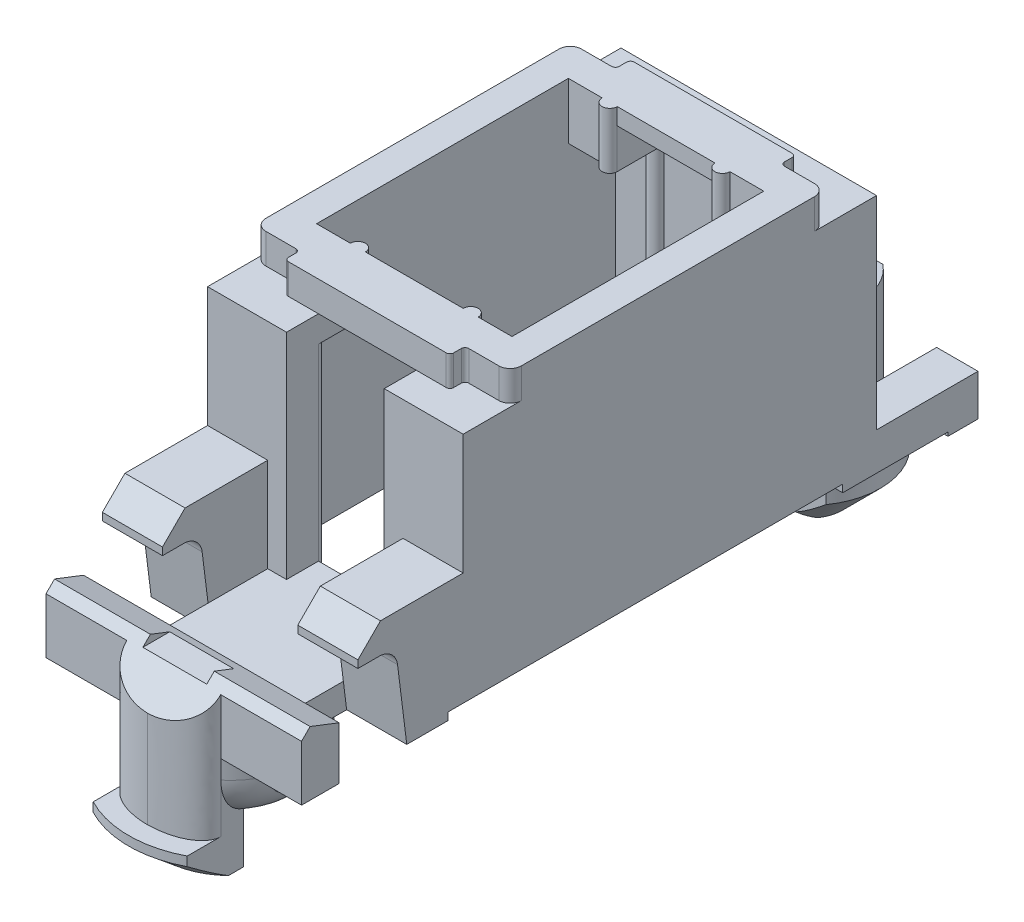
from build123d import *

# Parameters (mm, degrees)
BOSS_EXTRUDE1_DEPTH     = 3.4
CUT_EXTRUDE1_DEPTH      = 12.56460116
CUT_EXTRUDE1_DEPTH_BACK = 12.56460116
SKETCH3_W               = 3.6
SKETCH3_H               = 5.6
SKETCH3_W_2             = 4.6
SKETCH3_H_2             = 5.4
SKETCH4_W               = 2.6
SKETCH4_H               = 12.8
CUT_EXTRUDE3_DEPTH      = 2.8
SKETCH5_OUTSIDE_W       = 12.656
SKETCH5_OUTSIDE_H       = 22.356
CUT_EXTRUDE4_DEPTH      = 0.8
CUT_EXTRUDE5_DEPTH      = 5.5
CUT_EXTRUDE6_DEPTH      = 1.3
CUT_EXTRUDE6_DEPTH_BACK = 1.3
BOSS_EXTRUDE2_REACH     = 12.47
CUT_EXTRUDE7_DEPTH      = 13.241323458
CUT_EXTRUDE7_DEPTH_BACK = 13.241323458
SKETCH11_W              = 6.8
SKETCH11_H              = 4.491916375
CUT_EXTRUDE8_START      = -2.200001
SKETCH12_W              = 1.498956088
SKETCH12_H              = 8.6
CUT_EXTRUDE8_DEPTH      = 2.200002
BOSS_EXTRUDE3_DEPTH     = 0.5
SKETCH14_W              = 4.6
SKETCH14_H              = 0.5
CUT_EXTRUDE9_DEPTH      = 1.4
BOSS_EXTRUDE4_START     = -0.866025
BOSS_EXTRUDE4_DEPTH     = 1.73205
SKETCH16_W              = 0.732050808
SKETCH16_H              = 2.4
CUT_EXTRUDE10_DEPTH     = 4.2
FILLET1_R               = 0.5
FILLET2_R               = 0.2
SKETCH17_R              = 1.95
SKETCH17_R_2            = 0.85
BOSS_EXTRUDE6_DEPTH     = 1.5
FILLET3_SIZE            = 1
FILLET3_SIZE_2          = 0.6
CUT_EXTRUDE11_DEPTH     = 1.5
CUT_EXTRUDE13_START     = -6.4
CUT_EXTRUDE13_OUTLINE_R = 0.799999943
CUT_EXTRUDE13_DEPTH     = 3.5
BOSS_EXTRUDE8_DEPTH     = 3.4
BOSS_EXTRUDE9_REACH     = 15.222
FILLET5_START           = -5.4
FILLET5_DEPTH           = 3.5
SKETCH23_W              = 1.7
SKETCH23_H              = 0.4
CUT_EXTRUDE14_DEPTH     = 14.221573389


with BuildPart() as part:
    # Sketch2 → Boss-Extrude1 (new, symmetric)
    with BuildSketch(Plane(origin=(0, 0, 0), x_dir=(0, 0, -1), z_dir=(1, 0, 0))):
        with BuildLine():
            Line((-5.5, 3.6), (5.5, 3.6))
            Line((5.5, 3.6), (5.5, -2.599948203))
            Line((5.5, -2.599948203), (8.2, -2.599948203))
            Line((8.2, -2.599948203), (8.2, -3.7))
            Line((8.2, -3.7), (7.4, -3.7))
            Line((7.4, -3.7), (7.4, -3.6))
            Line((7.4, -3.6), (4.6, -3.6))
            Line((4.6, -3.6), (4.6, -3.4))
            Line((4.6, -3.4), (-5.9, -3.4))
            Line((-5.9, -3.4), (-5.9, -3.6))
            Line((-5.9, -3.6), (-7, -3.6))
            Line((-7, -3.6), (-7.245252171, -1.637982633))
            ThreePointArc((-7.245252171, -1.637982633), (-7.410489828, -1.325160912), (-7.741391109, -1.2))
            Line((-7.741391109, -1.2), (-8.3, -1.2))
            Line((-8.3, -1.2), (-8.3, -1))
            Line((-8.3, -1), (-7.7, -0.4))
            Line((-7.7, -0.4), (-5.5, -0.4))
            Line((-5.5, -0.4), (-5.5, 3.6))
        make_face()
    extrude(amount=BOSS_EXTRUDE1_DEPTH, both=True)

    # Sketch3 → Cut-Extrude1 (cut, two sides: drawn at the far end of the back side and taken through both)
    with BuildSketch(Plane(origin=(0, 3.6, 0), x_dir=(1, 0, 0), z_dir=(0, 1, 0)).offset(-CUT_EXTRUDE1_DEPTH_BACK)):
        with BuildLine():
            Line((-2.6, 3.3), (-1.7, 3.3))
            ThreePointArc((-1.7, 3.3), (-1.5, 3.1), (-1.3, 3.3))
            Line((-1.3, 3.3), (1.3, 3.3))
            ThreePointArc((1.3, 3.3), (1.5, 3.1), (1.7, 3.3))
            Line((1.7, 3.3), (2.6, 3.3))
            Line((2.6, 3.3), (2.6, -3.4))
            Line((2.6, -3.4), (1.7, -3.4))
            ThreePointArc((1.7, -3.4), (1.5, -3.2), (1.3, -3.4))
            Line((1.3, -3.4), (-1.3, -3.4))
            ThreePointArc((-1.3, -3.4), (-1.5, -3.2), (-1.7, -3.4))
            Line((-1.7, -3.4), (-2.6, -3.4))
            Line((-2.6, -3.4), (-2.6, 3.3))
        make_face()
        with Locations((0, -8.3)):
            Rectangle(SKETCH3_W, SKETCH3_H)
        with Locations((0, 8.2)):
            Rectangle(SKETCH3_W_2, SKETCH3_H_2)
    extrude(amount=CUT_EXTRUDE1_DEPTH + CUT_EXTRUDE1_DEPTH_BACK, mode=Mode.SUBTRACT)

    # Sketch4 → Cut-Extrude3 (cut)
    with BuildSketch(Plane.XY.offset(5.5)):
        with Locations((0, -3.6)):
            Rectangle(SKETCH4_W, SKETCH4_H)
    extrude(amount=-CUT_EXTRUDE3_DEPTH, mode=Mode.SUBTRACT)

    # Sketch5 outside → Cut-Extrude4 (cut)
    with BuildSketch(Plane(origin=(0, 3.6, 0), x_dir=(1, 0, 0), z_dir=(0, 1, 0))):
        with Locations((0, -0.05)):
            Rectangle(SKETCH5_OUTSIDE_W, SKETCH5_OUTSIDE_H)
        with BuildLine():
            Line((-2.1, -4.65), (2.1, -4.65))
            ThreePointArc((2.1, -4.65), (2.170710678, -4.620710678), (2.2, -4.55))
            Line((2.2, -4.55), (2.2, -4.35))
            ThreePointArc((2.2, -4.35), (2.229289322, -4.279289322), (2.3, -4.25))
            Line((2.3, -4.25), (3.1, -4.25))
            ThreePointArc((3.1, -4.25), (3.312132034, -4.162132034), (3.4, -3.95))
            Line((3.4, -3.95), (3.4, 3.85))
            ThreePointArc((3.4, 3.85), (3.312132034, 4.062132034), (3.1, 4.15))
            Line((3.1, 4.15), (2.3, 4.15))
            ThreePointArc((2.3, 4.15), (2.229289322, 4.179289322), (2.2, 4.25))
            Line((2.2, 4.25), (2.2, 4.45))
            ThreePointArc((2.2, 4.45), (2.170710678, 4.520710678), (2.1, 4.55))
            Line((2.1, 4.55), (-2.1, 4.55))
            ThreePointArc((-2.1, 4.55), (-2.170710678, 4.520710678), (-2.2, 4.45))
            Line((-2.2, 4.45), (-2.2, 4.25))
            ThreePointArc((-2.2, 4.25), (-2.229289322, 4.179289322), (-2.3, 4.15))
            Line((-2.3, 4.15), (-3.1, 4.15))
            ThreePointArc((-3.1, 4.15), (-3.312132034, 4.062132034), (-3.4, 3.85))
            Line((-3.4, 3.85), (-3.4, -3.95))
            ThreePointArc((-3.4, -3.95), (-3.312132034, -4.162132034), (-3.1, -4.25))
            Line((-3.1, -4.25), (-2.3, -4.25))
            ThreePointArc((-2.3, -4.25), (-2.229289322, -4.279289322), (-2.2, -4.35))
            Line((-2.2, -4.35), (-2.2, -4.55))
            ThreePointArc((-2.2, -4.55), (-2.170710678, -4.620710678), (-2.1, -4.65))
        make_face(mode=Mode.SUBTRACT)
    extrude(amount=-CUT_EXTRUDE4_DEPTH, mode=Mode.SUBTRACT)

    # Sketch6 → Cut-Extrude5 (cut)
    with BuildSketch(Plane.XZ.offset(3.4)):
        with BuildLine():
            Line((-2.6, 4.65), (-1.7, 4.65))
            ThreePointArc((-1.7, 4.65), (-1.5, 4.45), (-1.3, 4.65))
            Line((-1.3, 4.65), (1.3, 4.65))
            ThreePointArc((1.3, 4.65), (1.5, 4.45), (1.7, 4.65))
            Line((1.7, 4.65), (2.6, 4.65))
            Line((2.6, 4.65), (2.6, -2.52625277))
            Line((2.6, -2.52625277), (1.3, -2.52625277))
            Line((1.3, -2.52625277), (1.3, -4.55))
            Line((1.3, -4.55), (-1.3, -4.55))
            ThreePointArc((-1.3, -4.55), (-1.5, -4.35), (-1.7, -4.55))
            Line((-1.7, -4.55), (-2.6, -4.55))
            Line((-2.6, -4.55), (-2.6, 4.65))
        make_face()
    extrude(amount=-CUT_EXTRUDE5_DEPTH, mode=Mode.SUBTRACT)

    # Sketch7 → Cut-Extrude6 (cut, two sides: drawn at the far end of the back side and taken through both)
    with BuildSketch(Plane(origin=(0, 0, 0), x_dir=(0, 0, -1), z_dir=(1, 0, 0)).offset(-CUT_EXTRUDE6_DEPTH_BACK)):
        with BuildLine():
            Line((4.55, 1.317385314), (4.55, 2.634395244))
            ThreePointArc((4.55, 2.634395244), (4.462132034, 2.846527278), (4.25, 2.934395244))
            Line((4.25, 2.934395244), (3.569822156, 2.934395244))
            Line((3.569822156, 2.934395244), (3.569822156, 3.155123578))
            Line((3.569822156, 3.155123578), (3.3, 3.155123578))
            Line((3.3, 3.155123578), (3.3, 1.317385314))
            Line((3.3, 1.317385314), (4.55, 1.317385314))
        make_face()
    extrude(amount=CUT_EXTRUDE6_DEPTH + CUT_EXTRUDE6_DEPTH_BACK, mode=Mode.SUBTRACT)

    # Boss-Extrude2: up to this face of the body (flat: up to its plane)
    boss_extrude2_end = Plane(part.part.faces().sort_by_distance((1.8, -1.808679227, 6.50389603))[0])
    # Sketch8 → Boss-Extrude2 (add, up to the picked face)
    with BuildSketch(Plane(origin=(-1.8, 0, 0), x_dir=(0, 0, -1), z_dir=(1, 0, 0)), mode=Mode.PRIVATE) as boss_extrude2_sk1:
        Polygon((-4.65, -3.4), (-5.9, -3.4), (-5.9, -3.6), (-9.8, -3.6), (-9.8, -2.9), (-4.65, -2.9), align=None)
    boss_extrude2_tool1 = split(extrude(boss_extrude2_sk1.sketch, amount=BOSS_EXTRUDE2_REACH, mode=Mode.PRIVATE), bisect_by=boss_extrude2_end, keep=Keep.BOTH, mode=Mode.PRIVATE)
    add(boss_extrude2_tool1.solids().sort_by(Axis((-1.8, -3.231371, 7.370306), (1, 0, 0)))[0])

    # Sketch14 → Cut-Extrude9 (cut)
    with BuildSketch(Plane.XZ.offset(3.6)):
        with Locations((0, -5.5)):
            Rectangle(SKETCH14_W, SKETCH14_H)
    extrude(amount=-CUT_EXTRUDE9_DEPTH, mode=Mode.SUBTRACT)



with BuildPart() as body_2:
    # Sketch10 → Revolve1 (revolve)
    with BuildSketch(Plane(origin=(0, 0, 0), x_dir=(0, 0, -1), z_dir=(1, 0, 0)), mode=Mode.PRIVATE) as revolve1_sk:
        Polygon((7.1, -1.4), (8.5, -1.4), (8.5, -4.811324865), (9, -5.1), (9, -5.5), (8, -6.5), (7.1, -6.5), align=None)
    revolve(revolve1_sk.sketch.rotate(Axis((0, -1.4, -7.1), (0, -1, 0)), 180), axis=Axis((0, -1.4, -7.1), (0, -1, 0)))

    # Sketch11 → Cut-Extrude7 (cut, two sides: drawn at the far end of the back side and taken through both)
    with BuildSketch(Plane(origin=(0, 0, 0), x_dir=(1, 0, 0), z_dir=(0, 1, 0)).offset(-CUT_EXTRUDE7_DEPTH_BACK)):
        with Locations((0, 10.445958188)):
            Rectangle(SKETCH11_W, SKETCH11_H)
        with Locations((0, 3.754041813)):
            Rectangle(SKETCH11_W, SKETCH11_H)
    extrude(amount=CUT_EXTRUDE7_DEPTH + CUT_EXTRUDE7_DEPTH_BACK, mode=Mode.SUBTRACT)

    # Sketch12 → Cut-Extrude8 (cut)
    with BuildSketch(Plane(origin=(0, 0, -8.2), x_dir=(-1, 0, 0), z_dir=(0, 0, -1)).offset(CUT_EXTRUDE8_START)):
        with Locations((0, -6.5)):
            Rectangle(SKETCH12_W, SKETCH12_H)
    extrude(amount=CUT_EXTRUDE8_DEPTH, mode=Mode.SUBTRACT)

    # Sketch13 → Boss-Extrude3 (add, symmetric)
    with BuildSketch(Plane(origin=(0, 0, -7.1), x_dir=(-1, 0, 0), z_dir=(0, 0, -1))):
        Polygon((-0.5, -2.5), (0.5, -2.5), (0.749478044, -6), (0.749478044, -2.2), (-0.749478044, -2.2), (-0.749478044, -6), align=None)
    extrude(amount=BOSS_EXTRUDE3_DEPTH, both=True)


with BuildPart() as part_1:
    add(part.part)

    add(body_2.part)  # Boss-Extrude4 merges body 2
    # Sketch15 → Boss-Extrude4 (add)
    with BuildSketch(Plane(origin=(0, 0, 0), x_dir=(0, 0, -1), z_dir=(1, 0, 0)).offset(BOSS_EXTRUDE4_START)):
        Polygon((6, -2.2), (5.5, -2.2), (5.5, -0.2), (6.7, -1.4), (6, -1.4), align=None)
    extrude(amount=BOSS_EXTRUDE4_DEPTH)

    # Sketch16 → Cut-Extrude10 (cut)
    with BuildSketch(Plane(origin=(0, 2.8, 0), x_dir=(1, 0, 0), z_dir=(0, 1, 0))):
        with Locations((0, 6.7)):
            Rectangle(SKETCH16_W, SKETCH16_H)
    extrude(amount=-CUT_EXTRUDE10_DEPTH, mode=Mode.SUBTRACT)

    # Fillet1
    fillet1_edges = [part_1.edges().sort_by_distance(p)[0] for p in [
        (-0.616025202, -1.4, -6.7),
        (0.616025202, -1.4, -6.7),
    ]]
    fillet(fillet1_edges, radius=FILLET1_R)

    # Fillet2
    fillet2_edges = [part_1.edges().sort_by_distance(p)[0] for p in [
        (0, -1.4, -5.5),
    ]]
    fillet(fillet2_edges, radius=FILLET2_R)

    # Sketch17 → Boss-Extrude6 (add)
    with BuildSketch(Plane.XZ.offset(3.6)):
        with Locations(Location((0, 8.3, 0), (0, 0, 50.284862768))):
            Circle(SKETCH17_R)
        with Locations(Location((0, 8.3, 0), (0, 0, 270))):
            Circle(SKETCH17_R_2, mode=Mode.SUBTRACT)
    extrude(amount=BOSS_EXTRUDE6_DEPTH)

    # Fillet3
    # a fillet whose section is not a circle: 1, 0.6 mm, written as the material it takes off along each edge
    with BuildSketch(Plane(origin=(0, -5.1, 8.3), x_dir=(0.6389710663806469, 0, 0.7692307692288309), z_dir=(0.7692307692288309, 0, -0.6389710663806469))) as fillet3_piece_1:
        with BuildLine():
            Bezier((1.95, -FILLET3_SIZE), (1.95, 0), (1.95 - FILLET3_SIZE_2, 0), weights=[1, 0.707106781, 1])
            Line((1.95 - FILLET3_SIZE_2, 0), (1.95, 0))
            Line((1.95, 0), (1.95, -FILLET3_SIZE))
        make_face()
    revolve(axis=Axis((0, -5.1, 8.3), (0, -1, 0)), mode=Mode.SUBTRACT)

    # Sketch18 → Cut-Extrude11 (cut)
    with BuildSketch(Plane(origin=(0, -3.6, 0), x_dir=(1, 0, 0), z_dir=(0, 1, 0))):
        with BuildLine():
            Line((-1.8, -9.05), (-1.8, -7.55))
            ThreePointArc((-1.8, -7.55), (-1.95, -8.3), (-1.8, -9.05))
        make_face()
        with BuildLine():
            Line((1.8, -7.55), (1.8, -9.05))
            ThreePointArc((1.8, -9.05), (1.95, -8.3), (1.8, -7.55))
        make_face()
    extrude(amount=-CUT_EXTRUDE11_DEPTH, mode=Mode.SUBTRACT)


with BuildPart() as body_2_2:
    # Sketch19 → Revolve2 (revolve)
    with BuildSketch(Plane(origin=(0, 0, 0), x_dir=(0, 0, -1), z_dir=(1, 0, 0)), mode=Mode.PRIVATE) as revolve2_sk:
        Polygon((-9.1, -2.9), (-9.1, -6.4), (-10.1, -6.4), (-11, -5.644810332), (-11, -5.4), (-10.5, -5.4), (-10.5, -2.9), align=None)
    revolve(revolve2_sk.sketch.rotate(Axis((0, -5.1, 8.300000057), (0, 1, 0)), 180), axis=Axis((0, -5.1, 8.300000057), (0, 1, 0)))

    # Cut-Extrude13: read off the stored shape, not the designer's step
    # Cut-Extrude13 outline → Cut-Extrude13 (cut)
    with BuildSketch(Plane(origin=(0, 0, 0), x_dir=(1, 0, 0), z_dir=(0, 1, 0)).offset(CUT_EXTRUDE13_START)):
        with BuildLine():
            Line((-1.25, -9.2), (1.25, -9.2))
            Line((1.25, -9.2), (1.25, -10.693219581))
            ThreePointArc((1.25, -10.693219581), (0, -5.600000114), (-1.25, -10.693219581))
            Line((-1.25, -10.693219581), (-1.25, -9.2))
        make_face()
        with Locations((0, -8.300000057)):
            Circle(CUT_EXTRUDE13_OUTLINE_R, mode=Mode.SUBTRACT)
    extrude(amount=CUT_EXTRUDE13_DEPTH, mode=Mode.SUBTRACT)

    # Combine1: union part
    add(part_1.part)

    # Sketch21 → Boss-Extrude8 (add, symmetric)
    with BuildSketch(Plane(origin=(0, 0, 0), x_dir=(0, 0, -1), z_dir=(1, 0, 0))):
        Polygon((-9.8, -3.6), (-8.8, -3.6), (-8.8, -2.2), (-9.572373963, -1.9), (-9.8, -2.127626037), align=None)
    extrude(amount=BOSS_EXTRUDE8_DEPTH, both=True)

    # Boss-Extrude9: up to this plane
    boss_extrude9_end = Plane(origin=(3.4, -1.9, 9.572373963), z_dir=(0, -0.7071067811865492, -0.7071067811865458))
    # Sketch22 → Boss-Extrude9 (add, up to the surface)
    with BuildSketch(Plane(origin=(0, -2.9, 0), x_dir=(1, 0, 0), z_dir=(0, 1, 0)), mode=Mode.PRIVATE) as boss_extrude9_sk1:
        with BuildLine():
            Line((1.25, -9.8), (-1.25, -9.8))
            Line((-1.25, -9.8), (-1.25, -10.110386687))
            ThreePointArc((-1.25, -10.110386687), (0, -10.5), (1.25, -10.110386687))
            Line((1.25, -10.110386687), (1.25, -9.8))
        make_face()
    boss_extrude9_tool1 = split(extrude(boss_extrude9_sk1.sketch, amount=BOSS_EXTRUDE9_REACH, mode=Mode.PRIVATE), bisect_by=boss_extrude9_end, keep=Keep.BOTH, mode=Mode.PRIVATE)
    add(boss_extrude9_tool1.solids().sort_by_distance((0, -2.9, 10.098938))[0])

    # Fillet5: read off the stored shape, not the designer's step
    # Fillet5 outline → Fillet5 (cut)
    with BuildSketch(Plane(origin=(0, 0, 0), x_dir=(1, 0, 0), z_dir=(0, 1, 0)).offset(FILLET5_START)):
        with BuildLine():
            ThreePointArc((-1.25, -10.110386687), (-0.824068618, -10.339831095), (-0.358285297, -10.47062932))
            add(Edge.make_bspline(
                [(-0.358285297, -10.47062932), (-1.25, -10.321230065), (-1.25, -9.8)],
                knots=[0.195184873, 0.195184873, 0.195184873, 1, 1, 1], degree=2, weights=[0.907980133, 0.764275107, 1]))
            Line((-1.25, -9.8), (-1.25, -10.110386687))
        make_face()
        with BuildLine():
            add(Edge.make_bspline(
                [(1.25, -9.8), (1.25, -10.321230065), (0.358285297, -10.47062932)],
                knots=[0, 0, 0, 0.804815127, 0.804815127, 0.804815127], degree=2, weights=[1, 0.764275107, 0.907980133]))
            ThreePointArc((0.358285297, -10.47062932), (0.824068618, -10.339831095), (1.25, -10.110386687))
            Line((1.25, -10.110386687), (1.25, -9.8))
        make_face()
    extrude(amount=FILLET5_DEPTH, mode=Mode.SUBTRACT)

    # Sketch23 → Cut-Extrude14 (cut, through all)
    with BuildSketch(Plane.XY):
        with Locations((0, -1.9)):
            Rectangle(SKETCH23_W, SKETCH23_H)
    extrude(amount=CUT_EXTRUDE14_DEPTH, mode=Mode.SUBTRACT)


solid = body_2_2.part
